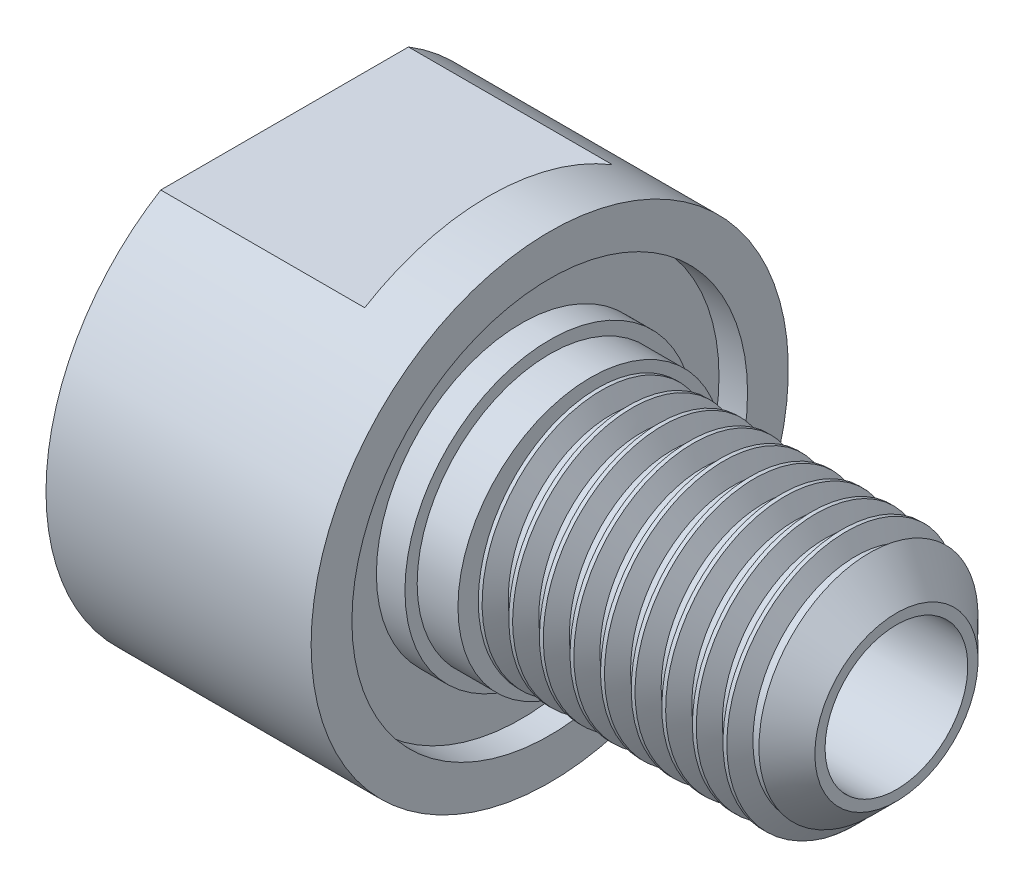
from build123d import *

# Parameters (mm, degrees)
CORTE_EXTRUS_O1_START = -10
CORTE_EXTRUS_O1_DEPTH = 11
ROSCA1_PITCH          = 1.5
ROSCA1_TO             = 17


with BuildPart() as part:
    # Esboço1 → Revolução1 (revolve)
    with BuildSketch(Plane.XY, mode=Mode.PRIVATE) as revolu_o1_sk:
        Polygon((0, 11.7), (0, 9.7), (-1.4, 9.7), (-1.4, 7.1), (0, 7.1), (0, 6.5), (2, 6.5), (2, 6), (17, 6), (17, 3.5), (9, 3.5), (9, 3), (3.6, 3), (3.6, 3.5), (-4.4, 3.5), (-4.4, 7.7), (-13, 7.7), (-13, 11.7), align=None)
    revolve(revolu_o1_sk.sketch.rotate(Axis((-7.786191537, 0, 0), (1, 0, 0)), 90), axis=Axis((-7.786191537, 0, 0), (1, 0, 0)))

    # Corte-extrusão1: read off the stored shape, not the designer's step
    # Corte-extrusão1 outline → Corte-extrusão1 (cut)
    with BuildSketch(Plane.ZY.offset(13).offset(CORTE_EXTRUS_O1_START)):
        with BuildLine():
            Line((-6.073713856, 10), (6.073713856, 10))
            ThreePointArc((6.073713856, 10), (0, 11.7), (-6.073713856, 10))
        make_face()
        with BuildLine():
            Line((6.073713856, -10), (-6.073713856, -10))
            ThreePointArc((-6.073713856, -10), (0, -11.7), (6.073713856, -10))
        make_face()
    extrude(amount=CORTE_EXTRUS_O1_DEPTH, mode=Mode.SUBTRACT)

    # Rosca1: arcs per turn and ends read off the stored shape
    # Rosca1: the profile of Perfil da rosca1 profile screwed along a right-hand helix through 11.333333 turns, 8 arcs to a turn; built about Z, then put on its axis
    rosca1_z = Axis((0, 0, 0), (0, 0, 1))
    rosca1_corners = [(6.0003, 0, -0.000173205), (6.0003, 0, 1.312673201), (5.188101187, 0, 0.843749998), (5.188101187, 0, 0.468749998)]
    with BuildLine(mode=Mode.PRIVATE) as rosca1_profile:
        Line(rosca1_corners[0], rosca1_corners[1])
        Line(rosca1_corners[1], rosca1_corners[2])
        Line(rosca1_corners[2], rosca1_corners[3])
        Line(rosca1_corners[3], rosca1_corners[0])
    rosca1_cap = Face(rosca1_profile.wire())
    rosca1_turn_angles = [0, 22.5, 45, 67.5, 90, 112.5, 135, 157.5, 180, 202.5, 225, 247.5, 270, 292.5, 315, 337.5, 360]
    rosca1_turn_weights = [1, 0.9238795325112867, 1, 0.9238795325112867, 1, 0.9238795325112867, 1, 0.9238795325112867, 1, 0.9238795325112867, 1, 0.9238795325112867, 1, 0.9238795325112867, 1, 0.9238795325112867, 1]
    rosca1_turn_rails = [Edge.make_bspline([Vector(p[0], p[1], 0).rotate(rosca1_z, rosca1_turn_angles[k]) / rosca1_turn_weights[k] + Vector(0, 0, p[2] + ROSCA1_PITCH * rosca1_turn_angles[k] / 360) for k in range(17)], [0, 0, 0, 1, 1, 2, 2, 3, 3, 4, 4, 5, 5, 6, 6, 7, 7, 8, 8, 8], 2, rosca1_turn_weights) for p in rosca1_corners]
    rosca1_turn_sides = [Face.make_surface_from_curves(rosca1_turn_rails[p[0]], rosca1_turn_rails[p[1]]) for p in [(0, 1), (1, 2), (2, 3), (3, 0)]]
    rosca1_last_angles = [3960, 3982.5, 4005, 4027.5, 4050, 4065, 4080]
    rosca1_last_weights = [1, 0.9238795325112867, 1, 0.9238795325112867, 1, 0.9659258262890693, 1]
    rosca1_last_rails = [Edge.make_bspline([Vector(p[0], p[1], 0).rotate(rosca1_z, rosca1_last_angles[k]) / rosca1_last_weights[k] + Vector(0, 0, p[2] + ROSCA1_PITCH * rosca1_last_angles[k] / 360) for k in range(7)], [0, 0, 0, 1, 1, 2, 2, 3, 3, 3], 2, rosca1_last_weights) for p in rosca1_corners]
    rosca1_last_sides = [Face.make_surface_from_curves(rosca1_last_rails[p[0]], rosca1_last_rails[p[1]]) for p in [(0, 1), (1, 2), (2, 3), (3, 0)]]
    rosca1 = Plane(origin=(19, 0, 0), x_dir=(0, 0, 1), z_dir=(-1, 0, 0)) * split(Solid(Shell([*[p.moved(Location((0, 0, ROSCA1_PITCH * i))) for i in range(11) for p in rosca1_turn_sides], *rosca1_last_sides, rosca1_cap, rosca1_cap.rotate(rosca1_z, 4080).moved(Location((0, 0, ROSCA1_PITCH * 4080 / 360)))])), bisect_by=Plane.XY.offset(ROSCA1_TO), keep=Keep.BOTTOM, mode=Mode.PRIVATE)
    add(rosca1, mode=Mode.SUBTRACT)

    # Esboço4 → Corte-Revolução1 (revolve, cut)
    with BuildSketch(Plane.XY, mode=Mode.PRIVATE) as corte_revolu_o1_sk:
        Polygon((12, 9), (17, 9), (17, 4), align=None)
    revolve(corte_revolu_o1_sk.sketch.rotate(Axis((-18.146274885, 0, 0), (1, 0, 0)), 90), axis=Axis((-18.146274885, 0, 0), (1, 0, 0)), mode=Mode.SUBTRACT)


solid = part.part
